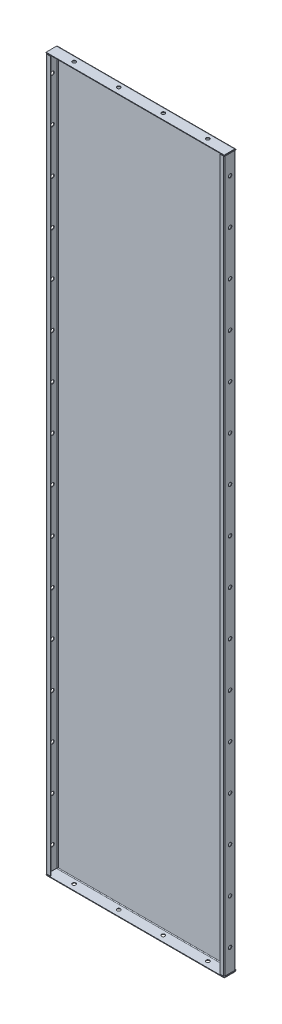
from build123d import *

# Parameters (mm, degrees)
SKETCH1_W                      = 608
SKETCH1_H                      = 2432
BASE_FLANGE1_DEPTH             = 2
EDGE_FLANGE5_STRIP_W           = 13
EDGE_FLANGE5_STRIP_H           = 2
EDGE_FLANGE5_STRIP_CUT_DEPTH   = 608
EDGE_FLANGE5_STRIP_2_W         = 13
EDGE_FLANGE5_STRIP_2_H         = 2
EDGE_FLANGE5_STRIP_CUT_2_DEPTH = 608
EDGE_FLANGE5_DEPTH             = 608
EDGE_FLANGE5_BEND_DEPTH        = 608
EDGE_FLANGE1_STRIP_W           = 13
EDGE_FLANGE1_STRIP_H           = 2
EDGE_FLANGE1_STRIP_CUT_DEPTH   = 2423
EDGE_FLANGE1_STRIP_2_W         = 13
EDGE_FLANGE1_STRIP_2_H         = 2
EDGE_FLANGE1_STRIP_CUT_2_DEPTH = 2423
EDGE_FLANGE1_DEPTH             = 2423
EDGE_FLANGE1_BEND_DEPTH        = 2423
EDGE_FLANGE3_STRIP_W           = 9.4732
EDGE_FLANGE3_STRIP_H           = 2
EDGE_FLANGE3_STRIP_CUT_DEPTH   = 2423
EDGE_FLANGE3_STRIP_2_W         = 9.4732
EDGE_FLANGE3_STRIP_2_H         = 2
EDGE_FLANGE3_STRIP_CUT_2_DEPTH = 2423
EDGE_FLANGE3_DEPTH             = 2423
EDGE_FLANGE3_BEND_DEPTH        = 2423
SKETCH35_R                     = 6
CUT_EXTRUDE1_DEPTH             = 1361.060292781
LPATTERN1_COUNT                = 16
LPATTERN1_PITCH                = 152
SKETCH37_R                     = 6
CUT_EXTRUDE3_DEPTH             = 2754.099344375
LPATTERN3_COUNT                = 4
LPATTERN3_PITCH                = 152


# Sheet-metal steps are written as plain solids
with BuildPart() as part:
    # Sketch1 → Base-Flange1 (new body)
    with BuildSketch(Plane.XY):
        Rectangle(SKETCH1_W, SKETCH1_H)
    extrude(amount=-BASE_FLANGE1_DEPTH)

    # Edge-Flange5 strip (across the edge) → Edge-Flange5 strip cut (cut)
    with BuildSketch(Plane(origin=(304, 1216, 0), x_dir=(0, -1, 0), z_dir=(-1, 0, 0))):
        with Locations((-2, -1)):
            Rectangle(EDGE_FLANGE5_STRIP_W, EDGE_FLANGE5_STRIP_H)
    extrude(amount=EDGE_FLANGE5_STRIP_CUT_DEPTH, mode=Mode.SUBTRACT)

    # Edge-Flange5 strip 2 (across the edge) → Edge-Flange5 strip cut 2 (cut)
    with BuildSketch(Plane(origin=(-304, -1216, 0), x_dir=(0, 1, 0), z_dir=(1, 0, 0))):
        with Locations((-2, -1)):
            Rectangle(EDGE_FLANGE5_STRIP_2_W, EDGE_FLANGE5_STRIP_2_H)
    extrude(amount=EDGE_FLANGE5_STRIP_CUT_2_DEPTH, mode=Mode.SUBTRACT)

    # Edge-Flange5 section (across the edge) → Edge-Flange5 (add)
    with BuildSketch(Plane(origin=(304, 1216, 0), x_dir=(0, -1, 0), z_dir=(-1, 0, 0))):
        with BuildLine():
            Line((0, 2.5), (0, 38))
            Line((0, 38), (2, 38))
            Line((2, 38), (2, 2.5))
            ThreePointArc((2, 2.5), (2.732233047, 0.732233047), (4.5, 0))
            Line((4.5, 0), (4.5, -2))
            ThreePointArc((4.5, -2), (1.318019485, -0.681980515), (0, 2.5))
        make_face()
    extrude(amount=EDGE_FLANGE5_DEPTH)

    # Edge-Flange5 section 2 (across the edge) → Edge-Flange5 bend (add)
    with BuildSketch(Plane(origin=(-304, -1216, 0), x_dir=(0, 1, 0), z_dir=(1, 0, 0))):
        with BuildLine():
            Line((0, 2.5), (0, 38))
            Line((0, 38), (2, 38))
            Line((2, 38), (2, 2.5))
            ThreePointArc((2, 2.5), (2.732233047, 0.732233047), (4.5, 0))
            Line((4.5, 0), (4.5, -2))
            ThreePointArc((4.5, -2), (1.318019485, -0.681980515), (0, 2.5))
        make_face()
    extrude(amount=EDGE_FLANGE5_BEND_DEPTH)

    # Edge-Flange1 strip (across the edge) → Edge-Flange1 strip cut (cut)
    with BuildSketch(Plane(origin=(304, -1211.5, 0), x_dir=(-1, 0, 0), z_dir=(0, 1, 0))):
        with Locations((-2, -1)):
            Rectangle(EDGE_FLANGE1_STRIP_W, EDGE_FLANGE1_STRIP_H)
    extrude(amount=EDGE_FLANGE1_STRIP_CUT_DEPTH, mode=Mode.SUBTRACT)

    # Edge-Flange1 strip 2 (across the edge) → Edge-Flange1 strip cut 2 (cut)
    with BuildSketch(Plane(origin=(-304, 1211.5, 0), x_dir=(1, 0, 0), z_dir=(0, -1, 0))):
        with Locations((-2, -1)):
            Rectangle(EDGE_FLANGE1_STRIP_2_W, EDGE_FLANGE1_STRIP_2_H)
    extrude(amount=EDGE_FLANGE1_STRIP_CUT_2_DEPTH, mode=Mode.SUBTRACT)

    # Edge-Flange1 section (across the edge) → Edge-Flange1 (add)
    with BuildSketch(Plane(origin=(304, -1211.5, 0), x_dir=(-1, 0, 0), z_dir=(0, 1, 0))):
        with BuildLine():
            Line((0, 2.5), (0, 38))
            Line((0, 38), (2, 38))
            Line((2, 38), (2, 2.5))
            ThreePointArc((2, 2.5), (2.732233047, 0.732233047), (4.5, 0))
            Line((4.5, 0), (4.5, -2))
            ThreePointArc((4.5, -2), (1.318019485, -0.681980515), (0, 2.5))
        make_face()
    extrude(amount=EDGE_FLANGE1_DEPTH)

    # Edge-Flange1 section 2 (across the edge) → Edge-Flange1 bend (add)
    with BuildSketch(Plane(origin=(-304, 1211.5, 0), x_dir=(1, 0, 0), z_dir=(0, -1, 0))):
        with BuildLine():
            Line((0, 2.5), (0, 38))
            Line((0, 38), (2, 38))
            Line((2, 38), (2, 2.5))
            ThreePointArc((2, 2.5), (2.732233047, 0.732233047), (4.5, 0))
            Line((4.5, 0), (4.5, -2))
            ThreePointArc((4.5, -2), (1.318019485, -0.681980515), (0, 2.5))
        make_face()
    extrude(amount=EDGE_FLANGE1_BEND_DEPTH)

    # Edge-Flange3 strip (across the edge) → Edge-Flange3 strip cut (cut)
    with BuildSketch(Plane(origin=(302, -1211.5, 38), x_dir=(0, 0, -1), z_dir=(0, 1, 0))):
        with Locations((-2, -1)):
            Rectangle(EDGE_FLANGE3_STRIP_W, EDGE_FLANGE3_STRIP_H)
    extrude(amount=EDGE_FLANGE3_STRIP_CUT_DEPTH, mode=Mode.SUBTRACT)

    # Edge-Flange3 strip 2 (across the edge) → Edge-Flange3 strip cut 2 (cut)
    with BuildSketch(Plane(origin=(-302, 1211.5, 38), x_dir=(0, 0, -1), z_dir=(0, -1, 0))):
        with Locations((-2, -1)):
            Rectangle(EDGE_FLANGE3_STRIP_2_W, EDGE_FLANGE3_STRIP_2_H)
    extrude(amount=EDGE_FLANGE3_STRIP_CUT_2_DEPTH, mode=Mode.SUBTRACT)

    # Edge-Flange3 section (across the edge) → Edge-Flange3 (add)
    with BuildSketch(Plane(origin=(302, -1211.5, 38), x_dir=(0, 0, -1), z_dir=(0, 1, 0))):
        with BuildLine():
            Line((0, 0.7366), (0, 13))
            Line((0, 13), (2, 13))
            Line((2, 13), (2, 0.7366))
            ThreePointArc((2, 0.7366), (2.215745145, 0.215745145), (2.7366, 0))
            Line((2.7366, 0), (2.7366, -2))
            ThreePointArc((2.7366, -2), (0.801531583, -1.198468417), (0, 0.7366))
        make_face()
    extrude(amount=EDGE_FLANGE3_DEPTH)

    # Edge-Flange3 section 2 (across the edge) → Edge-Flange3 bend (add)
    with BuildSketch(Plane(origin=(-302, 1211.5, 38), x_dir=(0, 0, -1), z_dir=(0, -1, 0))):
        with BuildLine():
            Line((0, 0.7366), (0, 13))
            Line((0, 13), (2, 13))
            Line((2, 13), (2, 0.7366))
            ThreePointArc((2, 0.7366), (2.215745145, 0.215745145), (2.7366, 0))
            Line((2.7366, 0), (2.7366, -2))
            ThreePointArc((2.7366, -2), (0.801531583, -1.198468417), (0, 0.7366))
        make_face()
    extrude(amount=EDGE_FLANGE3_BEND_DEPTH)

    # Sketch35 → Cut-Extrude1 (cut, through all)
    with BuildSketch(Plane(origin=(304, 0, 0), x_dir=(0, 0, -1), z_dir=(1, 0, 0))):
        with Locations((-18, -1135.5)):
            Circle(SKETCH35_R)
    cut_extrude1 = extrude(amount=-CUT_EXTRUDE1_DEPTH, mode=Mode.SUBTRACT)

    # LPattern1: Cut-Extrude1 ×16
    with Locations(*[(0, i * LPATTERN1_PITCH, 0) for i in range(1, LPATTERN1_COUNT)]):
        add(cut_extrude1, mode=Mode.SUBTRACT)

    # Sketch37 → Cut-Extrude3 (cut, through all)
    with BuildSketch(Plane(origin=(0, 1216, -1216), x_dir=(1, 0, 0), z_dir=(0, -1, 0))):
        with Locations(Location((228, 1234, 0), (0, 0, 90))):
            Circle(SKETCH37_R)
    cut_extrude3 = extrude(amount=CUT_EXTRUDE3_DEPTH, mode=Mode.SUBTRACT)

    # LPattern3: Cut-Extrude3 ×4
    with Locations(*[(-i * LPATTERN3_PITCH, 0, 0) for i in range(1, LPATTERN3_COUNT)]):
        add(cut_extrude3, mode=Mode.SUBTRACT)


solid = part.part
